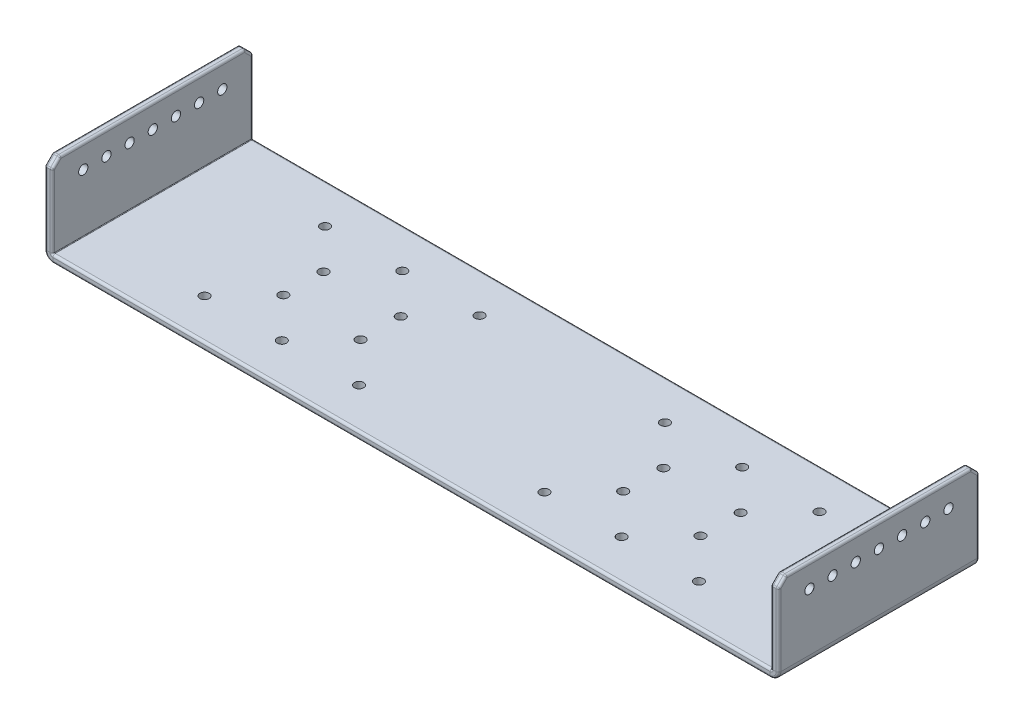
from build123d import *

# Parameters (mm, degrees)
SKETCH1_W                       = 950
SKETCH1_H                       = 260
BASE_FLANGE1_DEPTH              = 10
EDGE_FLANGE1_STRIP_W            = 41.4732
EDGE_FLANGE1_STRIP_H            = 10
EDGE_FLANGE1_STRIP_CUT_DEPTH    = 260
EDGE_FLANGE1_STRIP_2_W          = 41.4732
EDGE_FLANGE1_STRIP_2_H          = 10
EDGE_FLANGE1_STRIP_CUT_2_DEPTH  = 260
EDGE_FLANGE1_DEPTH              = 260
EDGE_FLANGE1_BEND_DEPTH         = 260
BREAK_CORNER1_START             = -475
BREAK_CORNER1_DEPTH             = 950
M10_CLEARANCE_HOLE1_D           = 12
M10_CLEARANCE_HOLE1_CSINK_D     = 12.05
M10_CLEARANCE_HOLE1_CSINK_ANGLE = 90
M10_CLEARANCE_HOLE2_D           = 12
M10_CLEARANCE_HOLE2_CSINK_D     = 12.05
M10_CLEARANCE_HOLE2_CSINK_ANGLE = 90
FILLET1_R                       = 3


# Read off the part's stored shape, not the designer's step: Break-Corner1
# Sheet-metal steps are written as plain solids
with BuildPart() as part:
    # Sketch1 → Base-Flange1 (new body)
    with BuildSketch(Plane(origin=(0, 0, 0), x_dir=(1, 0, 0), z_dir=(0, 1, 0))):
        Rectangle(SKETCH1_W, SKETCH1_H)
    extrude(amount=-BASE_FLANGE1_DEPTH)

    # Edge-Flange1 strip (across the edge) → Edge-Flange1 strip cut (cut)
    with BuildSketch(Plane(origin=(-475, 0, -130), x_dir=(1, 0, 0), z_dir=(0, 0, 1))):
        with Locations((-10, -5)):
            Rectangle(EDGE_FLANGE1_STRIP_W, EDGE_FLANGE1_STRIP_H)
    extrude(amount=EDGE_FLANGE1_STRIP_CUT_DEPTH, mode=Mode.SUBTRACT)

    # Edge-Flange1 strip 2 (across the edge) → Edge-Flange1 strip cut 2 (cut)
    with BuildSketch(Plane(origin=(475, 0, 130), x_dir=(-1, 0, 0), z_dir=(0, 0, -1))):
        with Locations((-10, -5)):
            Rectangle(EDGE_FLANGE1_STRIP_2_W, EDGE_FLANGE1_STRIP_2_H)
    extrude(amount=EDGE_FLANGE1_STRIP_CUT_2_DEPTH, mode=Mode.SUBTRACT)

    # Edge-Flange1 section (across the edge) → Edge-Flange1 (add)
    with BuildSketch(Plane(origin=(-475, 0, -130), x_dir=(1, 0, 0), z_dir=(0, 0, 1))):
        with BuildLine():
            Line((0, 0.7366), (0, 105))
            Line((0, 105), (10, 105))
            Line((10, 105), (10, 0.7366))
            ThreePointArc((10, 0.7366), (10.215745145, 0.215745145), (10.7366, 0))
            Line((10.7366, 0), (10.7366, -10))
            ThreePointArc((10.7366, -10), (3.144677333, -6.855322667), (0, 0.7366))
        make_face()
    extrude(amount=EDGE_FLANGE1_DEPTH)

    # Edge-Flange1 section 2 (across the edge) → Edge-Flange1 bend (add)
    with BuildSketch(Plane(origin=(475, 0, 130), x_dir=(-1, 0, 0), z_dir=(0, 0, -1))):
        with BuildLine():
            Line((0, 0.7366), (0, 105))
            Line((0, 105), (10, 105))
            Line((10, 105), (10, 0.7366))
            ThreePointArc((10, 0.7366), (10.215745145, 0.215745145), (10.7366, 0))
            Line((10.7366, 0), (10.7366, -10))
            ThreePointArc((10.7366, -10), (3.144677333, -6.855322667), (0, 0.7366))
        make_face()
    extrude(amount=EDGE_FLANGE1_BEND_DEPTH)

    # Break-Corner1 outline → Break-Corner1 (cut)
    with BuildSketch(Plane.YZ.offset(BREAK_CORNER1_START)):
        Polygon((105, 130), (95, 130), (105, 120), align=None)
        Polygon((105, -130), (105, -120), (95, -130), align=None)
    extrude(amount=BREAK_CORNER1_DEPTH, mode=Mode.SUBTRACT)

    # M10 Clearance Hole1 (through all)
    with Locations(Plane(origin=(475, 0, 0), x_dir=(0, 0, -1), z_dir=(1, 0, 0))):
        with Locations((-90, 75), (-60, 75), (-30, 75), (0, 75), (30, 75), (60, 75), (90, 75)):
            CounterSinkHole(M10_CLEARANCE_HOLE1_D / 2, M10_CLEARANCE_HOLE1_CSINK_D / 2, counter_sink_angle=M10_CLEARANCE_HOLE1_CSINK_ANGLE)

    # M10 Clearance Hole2 (through all)
    with Locations(Plane(origin=(0, -10, 0), x_dir=(-1, 0, 0), z_dir=(0, -1, 0))):
        with Locations((-320, 78), (-220, 78), (-120, 78), (-270, 26), (-170, 26), (-270, -26), (-170, -26), (-320, -78), (-220, -78), (-120, -78)):
            m10_clearance_hole2 = CounterSinkHole(M10_CLEARANCE_HOLE2_D / 2, M10_CLEARANCE_HOLE2_CSINK_D / 2, counter_sink_angle=M10_CLEARANCE_HOLE2_CSINK_ANGLE)

    # Mirror1: M10 Clearance Hole2 across plane
    add(m10_clearance_hole2.mirror(Plane(origin=(0, 0, 0), x_dir=(0, 0, 1), z_dir=(1, 0, 0))), mode=Mode.SUBTRACT)

    # Fillet1
    fillet1_edges = [part.edges().sort_by_distance(p)[0] for p in [
        (465, 100, 125),
        (470, 105, 120),
        (475, 100, 125),
        (0, 0, 130),
        (0, -10, 130),
        (0, 0, -130),
        (0, -10, -130),
        (-471.855322667, -6.855322667, -130),
        (-471.855322667, -6.855322667, 130),
        (-464.784254855, 0.215745145, -130),
        (-464.784254855, 0.215745145, 130),
        (-465, 47.8683, 130),
        (-475, 47.8683, 130),
        (471.855322667, -6.855322667, 130),
        (471.855322667, -6.855322667, -130),
        (464.784254855, 0.215745145, 130),
        (464.784254855, 0.215745145, -130),
        (465, 47.8683, -130),
        (475, 47.8683, -130),
        (-465, 105, 0),
        (-475, 105, 0),
        (-470, 105, 120),
        (-465, 100, 125),
        (-470, 95, 130),
        (-475, 100, 125),
        (-475, 47.8683, -130),
        (-465, 47.8683, -130),
        (-470, 95, -130),
        (-465, 100, -125),
        (-470, 105, -120),
        (-475, 100, -125),
        (465, 105, 0),
        (475, 105, 0),
        (470, 105, -120),
        (465, 100, -125),
        (470, 95, -130),
        (475, 100, -125),
        (475, 47.8683, 130),
        (465, 47.8683, 130),
        (470, 95, 130),
    ]]
    fillet(fillet1_edges, radius=FILLET1_R)


solid = part.part
